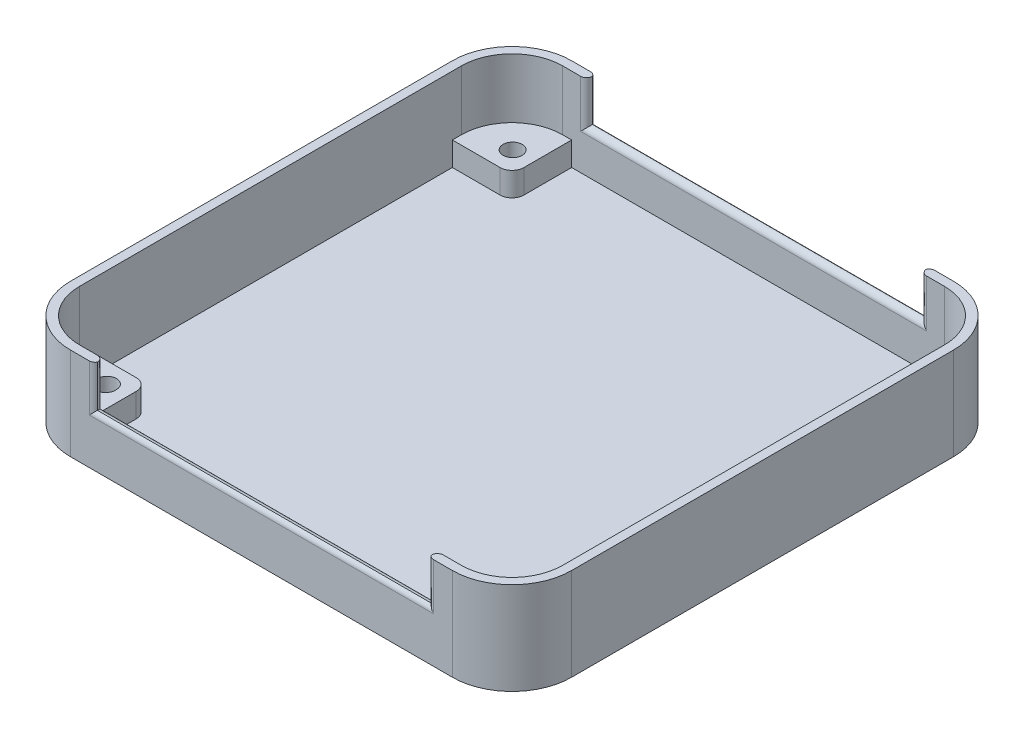
from build123d import *

# Parameters (mm, degrees)
EXTRUDE_1_DEPTH     = 1.5
EXTRUDE_2_DEPTH     = 14
EXTRUDE_3_OUTLINE_R = 1.60000381
EXTRUDE_3_DEPTH     = 4
SKETCH_4_W          = 56
SKETCH_4_H          = 7
CUT_EXTRUDE_1_DEPTH = 2
SKETCH_5_W          = 56
SKETCH_5_H          = 7
CUT_EXTRUDE_2_DEPTH = 2
FILLET_1_R          = 1
FILLET_2_R          = 1


with BuildPart() as part:
    # 草图1 → 凸台-拉伸1 (new body)
    with BuildSketch(Plane(origin=(0, 0, 0), x_dir=(1, 0, 0), z_dir=(0, 1, 0))):
        with BuildLine():
            Line((-32, 42), (32, 42))
            ThreePointArc((32, 42), (39.071067812, 39.071067812), (42, 32))
            Line((42, 32), (42, -32))
            ThreePointArc((42, -32), (39.071067812, -39.071067812), (32, -42))
            Line((32, -42), (-32, -42))
            ThreePointArc((-32, -42), (-39.071067812, -39.071067812), (-42, -32))
            Line((-42, -32), (-42, 32))
            ThreePointArc((-42, 32), (-39.071067812, 39.071067812), (-32, 42))
        make_face()
        with BuildLine():
            ThreePointArc((-32.412680975, -33.885727711), (-34.012684785, -32.285723901), (-35.612688595, -33.885727711))
            ThreePointArc((-35.612688595, -33.885727711), (-34.012684785, -35.485731521), (-32.412680975, -33.885727711))
        make_face(mode=Mode.SUBTRACT)
        with BuildLine():
            ThreePointArc((35.587491745, -33.885727711), (33.987487935, -32.285723901), (32.387484125, -33.885727711))
            ThreePointArc((32.387484125, -33.885727711), (33.987487935, -35.485731521), (35.587491745, -33.885727711))
        make_face(mode=Mode.SUBTRACT)
        with BuildLine():
            ThreePointArc((35.587491745, 34.114445009), (33.987487935, 35.714448819), (32.387484125, 34.114445009))
            ThreePointArc((32.387484125, 34.114445009), (33.987487935, 32.514441199), (35.587491745, 34.114445009))
        make_face(mode=Mode.SUBTRACT)
        with BuildLine():
            ThreePointArc((-32.412680975, 34.114445009), (-34.012684785, 35.714448819), (-35.612688595, 34.114445009))
            ThreePointArc((-35.612688595, 34.114445009), (-34.012684785, 32.514441199), (-32.412680975, 34.114445009))
        make_face(mode=Mode.SUBTRACT)
    extrude(amount=EXTRUDE_1_DEPTH)

    # 草图2 → 凸台-拉伸2 (add)
    with BuildSketch(Plane(origin=(0, 1.5, 0), x_dir=(1, 0, 0), z_dir=(0, 1, 0))):
        with BuildLine():
            Line((32, 42), (-32, 42))
            ThreePointArc((-32, 42), (-39.071067812, 39.071067812), (-42, 32))
            Line((-42, 32), (-42, -32))
            ThreePointArc((-42, -32), (-39.071067812, -39.071067812), (-32, -42))
            Line((-32, -42), (32, -42))
            ThreePointArc((32, -42), (39.071067812, -39.071067812), (42, -32))
            Line((42, -32), (42, 32))
            ThreePointArc((42, 32), (39.071067812, 39.071067812), (32, 42))
        make_face()
        with BuildLine():
            Line((-40.5, 32), (-40.5, -32))
            ThreePointArc((-40.5, -32), (-38.01040764, -38.01040764), (-32, -40.5))
            Line((-32, -40.5), (32, -40.5))
            ThreePointArc((32, -40.5), (38.01040764, -38.01040764), (40.5, -32))
            Line((40.5, -32), (40.5, 32))
            ThreePointArc((40.5, 32), (38.01040764, 38.01040764), (32, 40.5))
            Line((32, 40.5), (-32, 40.5))
            ThreePointArc((-32, 40.5), (-38.01040764, 38.01040764), (-40.5, 32))
        make_face(mode=Mode.SUBTRACT)
    extrude(amount=EXTRUDE_2_DEPTH)

    # 凸台-拉伸3: read off the stored shape, not the designer's step
    # 凸台-拉伸3 outline → 凸台-拉伸3 (add)
    # profile 1 of 4: a face of its own
    with BuildSketch(Plane(origin=(0, 1.5, 0), x_dir=(1, 0, 0), z_dir=(0, 1, 0))):
        with BuildLine():
            ThreePointArc((-32.5, 30.5), (-31.085786438, 31.085786438), (-30.5, 32.5))
            Line((-30.5, 32.5), (-30.5, 40.5))
            Line((-30.5, 40.5), (-32, 40.5))
            ThreePointArc((-32, 40.5), (-38.01040764, 38.01040764), (-40.5, 32))
            Line((-40.5, 32), (-40.5, 30.5))
            Line((-40.5, 30.5), (-32.5, 30.5))
        make_face()
        with Locations((-34.012684785, 34.114445009)):
            Circle(EXTRUDE_3_OUTLINE_R, mode=Mode.SUBTRACT)
    # profile 2 of 4: a face of its own
    with BuildSketch(Plane(origin=(0, 1.5, 0), x_dir=(1, 0, 0), z_dir=(0, 1, 0))):
        with BuildLine():
            Line((32, 40.5), (30.5, 40.5))
            Line((30.5, 40.5), (30.5, 32.5))
            ThreePointArc((30.5, 32.5), (31.085786438, 31.085786438), (32.5, 30.5))
            Line((32.5, 30.5), (40.5, 30.5))
            Line((40.5, 30.5), (40.5, 32))
            ThreePointArc((40.5, 32), (38.01040764, 38.01040764), (32, 40.5))
        make_face()
        with BuildLine():
            ThreePointArc((34.00008636, 32.5144908), (32.387484125, 34.114445009), (34.00008636, 35.714399218))
            ThreePointArc((34.00008636, 35.714399218), (35.612688595, 34.114445009), (34.00008636, 32.5144908))
        make_face(mode=Mode.SUBTRACT)
    # profile 3 of 4: a face of its own
    with BuildSketch(Plane(origin=(0, 1.5, 0), x_dir=(1, 0, 0), z_dir=(0, 1, 0))):
        with BuildLine():
            Line((-32.5, -30.5), (-40.5, -30.5))
            Line((-40.5, -30.5), (-40.5, -32))
            ThreePointArc((-40.5, -32), (-38.01040764, -38.01040764), (-32, -40.5))
            Line((-32, -40.5), (-30.5, -40.5))
            Line((-30.5, -40.5), (-30.5, -32.5))
            ThreePointArc((-30.5, -32.5), (-31.085786438, -31.085786438), (-32.5, -30.5))
        make_face()
        with BuildLine():
            ThreePointArc((-35.608596528, -34.00008636), (-34.012684785, -32.285723901), (-32.416773042, -34.00008636))
            ThreePointArc((-32.416773042, -34.00008636), (-34.012684785, -35.714448819), (-35.608596528, -34.00008636))
        make_face(mode=Mode.SUBTRACT)
    # profile 4 of 4: a face of its own
    with BuildSketch(Plane(origin=(0, 1.5, 0), x_dir=(1, 0, 0), z_dir=(0, 1, 0))):
        with BuildLine():
            Line((40.5, -32), (40.5, -30.5))
            Line((40.5, -30.5), (32.5, -30.5))
            ThreePointArc((32.5, -30.5), (31.085786438, -31.085786438), (30.5, -32.5))
            Line((30.5, -32.5), (30.5, -40.5))
            Line((30.5, -40.5), (32, -40.5))
            ThreePointArc((32, -40.5), (38.01040764, -38.01040764), (40.5, -32))
        make_face()
        with BuildLine():
            ThreePointArc((32.413821191, -34.174838714), (33.81228204, -32.295345654), (35.586351529, -33.825334006))
            ThreePointArc((35.586351529, -33.825334006), (34.18789068, -35.704827066), (32.413821191, -34.174838714))
        make_face(mode=Mode.SUBTRACT)
    extrude(amount=EXTRUDE_3_DEPTH)

    # 草图4 → 切除-拉伸1 (cut)
    with BuildSketch(Plane.XY.offset(42)):
        with Locations((0, 12)):
            Rectangle(SKETCH_4_W, SKETCH_4_H)
    extrude(amount=-CUT_EXTRUDE_1_DEPTH, mode=Mode.SUBTRACT)

    # 草图5 → 切除-拉伸2 (cut)
    with BuildSketch(Plane(origin=(0, 0, -42), x_dir=(-1, 0, 0), z_dir=(0, 0, -1))):
        with Locations((0, 12)):
            Rectangle(SKETCH_5_W, SKETCH_5_H)
    extrude(amount=-CUT_EXTRUDE_2_DEPTH, mode=Mode.SUBTRACT)

    # 圆角1
    fillet_1_edges = [part.edges().sort_by_distance(p)[0] for p in [
        (0, 8.5, 40.5),
        (28, 12, 40.5),
        (-28, 12, 40.5),
        (0, 8.5, -40.5),
        (-28, 12, -40.5),
        (28, 12, -40.5),
    ]]
    fillet(fillet_1_edges, radius=FILLET_1_R)

    # 圆角2
    # the kernel refuses this fillet: 1 mm, written as the material it takes off along each edge
    with BuildSketch(Plane(origin=(-28, 17.665063509, 42), x_dir=(-1, 0, 0), z_dir=(0, -1, 0))) as fillet_2_piece_1:
        with BuildLine():
            CenterArc((0.866025404, 1), FILLET_2_R, 210, 60)
            Line((0, 0.5), (-0.017320508, 0.49))
            ThreePointArc((-0.017320508, 0.49), (-0.02, 0.25), (-0.02, 0))
            Line((-0.02, 0), (0, -0.02))
            Line((0, -0.02), (0.866025404, -0.02))
            Line((0.866025404, -0.02), (0.866025404, 0))
        make_face()
    extrude(amount=9.165063509, mode=Mode.SUBTRACT)
    with BuildSketch(Plane(origin=(-28, 8.5, 42), x_dir=(0, -1, 0), z_dir=(1, 0, 0))) as fillet_2_piece_2:
        with BuildLine():
            CenterArc((0.866025404, 1), FILLET_2_R, 210, 60)
            Line((0, 0.5), (-0.017320508, 0.49))
            ThreePointArc((-0.017320508, 0.49), (-0.02, 0.25), (-0.02, 0))
            Line((-0.02, 0), (0, -0.02))
            Line((0, -0.02), (0.866025404, -0.02))
            Line((0.866025404, -0.02), (0.866025404, 0))
        make_face()
    extrude(amount=56, mode=Mode.SUBTRACT)
    with BuildSketch(Plane(origin=(28, 8.5, 42), x_dir=(0, 0, -1), z_dir=(0, 1, 0))) as fillet_2_piece_3:
        with BuildLine():
            CenterArc((1, -0.866025404), FILLET_2_R, 120, 60)
            Line((0, -0.866025404), (-0.02, -0.866025404))
            Line((-0.02, -0.866025404), (-0.02, 0))
            Line((-0.02, 0), (0, 0.02))
            ThreePointArc((0, 0.02), (0.25, 0.02), (0.49, 0.017320508))
            Line((0.49, 0.017320508), (0.5, 0))
        make_face()
    extrude(amount=9.165063509, mode=Mode.SUBTRACT)
    with BuildSketch(Plane(origin=(-28, 17.665063509, -42), x_dir=(-1, 0, 0), z_dir=(0, -1, 0)), Plane(origin=(28, 8.5, -42), x_dir=(1, 0, 0), z_dir=(0, 1, 0))) as fillet_2_piece_4:
        with BuildLine():
            CenterArc((0.866025404, -1), FILLET_2_R, 90, 60)
            Line((0, -0.5), (-0.017320508, -0.49))
            ThreePointArc((-0.017320508, -0.49), (-0.02, -0.25), (-0.02, 0))
            Line((-0.02, 0), (0, 0.02))
            Line((0, 0.02), (0.866025404, 0.02))
            Line((0.866025404, 0.02), (0.866025404, 0))
        make_face()
    extrude(amount=9.165063509, mode=Mode.SUBTRACT)
    with BuildSketch(Plane(origin=(-28, 8.5, -42), x_dir=(0, -1, 0), z_dir=(1, 0, 0))) as fillet_2_piece_5:
        with BuildLine():
            CenterArc((0.866025404, -1), FILLET_2_R, 90, 60)
            Line((0, -0.5), (-0.017320508, -0.49))
            ThreePointArc((-0.017320508, -0.49), (-0.02, -0.25), (-0.02, 0))
            Line((-0.02, 0), (0, 0.02))
            Line((0, 0.02), (0.866025404, 0.02))
            Line((0.866025404, 0.02), (0.866025404, 0))
        make_face()
    extrude(amount=56, mode=Mode.SUBTRACT)
    with BuildSketch(Plane(origin=(-28, 17.665063509, 42), x_dir=(-1, 0, 0), z_dir=(0, -1, 0))) as fillet_2_piece_6a_section:
        with BuildLine():
            CenterArc((0.866025404, 1), FILLET_2_R, 210, 60)
            Line((0, 0.5), (-0.017320508, 0.49))
            ThreePointArc((-0.017320508, 0.49), (-0.02, 0.25), (-0.02, 0))
            Line((-0.02, 0), (0, -0.02))
            Line((0, -0.02), (0.866025404, -0.02))
            Line((0.866025404, -0.02), (0.866025404, 0))
        make_face()
    fillet_2_piece_6a = extrude(amount=11.330127019, mode=Mode.PRIVATE)
    fillet_2_piece_6a = split(fillet_2_piece_6a, bisect_by=Plane(origin=(-28, 8.5, 42), z_dir=(0, -1, 0)), keep=Keep.TOP, mode=Mode.PRIVATE)
    with BuildSketch(Plane(origin=(-30.165063509, 8.5, 42), x_dir=(0, -1, 0), z_dir=(1, 0, 0))) as fillet_2_piece_6b_section:
        with BuildLine():
            CenterArc((0.866025404, 1), FILLET_2_R, 210, 60)
            Line((0, 0.5), (-0.017320508, 0.49))
            ThreePointArc((-0.017320508, 0.49), (-0.02, 0.25), (-0.02, 0))
            Line((-0.02, 0), (0, -0.02))
            Line((0, -0.02), (0.866025404, -0.02))
            Line((0.866025404, -0.02), (0.866025404, 0))
        make_face()
    fillet_2_piece_6b = extrude(amount=58.165063509, mode=Mode.PRIVATE)
    fillet_2_piece_6b = split(fillet_2_piece_6b, bisect_by=Plane(origin=(-28, 8.5, 42), z_dir=(-1, 0, 0)), keep=Keep.TOP, mode=Mode.PRIVATE)
    fillet_2_piece_6 = fillet_2_piece_6a & fillet_2_piece_6b
    add(fillet_2_piece_6, mode=Mode.SUBTRACT)
    with BuildSketch(Plane(origin=(28, 6.334936491, 42), x_dir=(0, 0, -1), z_dir=(0, 1, 0))) as fillet_2_piece_7a_section:
        with BuildLine():
            CenterArc((1, -0.866025404), FILLET_2_R, 120, 60)
            Line((0, -0.866025404), (-0.02, -0.866025404))
            Line((-0.02, -0.866025404), (-0.02, 0))
            Line((-0.02, 0), (0, 0.02))
            ThreePointArc((0, 0.02), (0.25, 0.02), (0.49, 0.017320508))
            Line((0.49, 0.017320508), (0.5, 0))
        make_face()
    fillet_2_piece_7a = extrude(amount=11.330127019, mode=Mode.PRIVATE)
    fillet_2_piece_7a = split(fillet_2_piece_7a, bisect_by=Plane(origin=(28, 8.5, 42), z_dir=(0, -1, 0)), keep=Keep.TOP, mode=Mode.PRIVATE)
    with BuildSketch(Plane(origin=(-28, 8.5, 42), x_dir=(0, -1, 0), z_dir=(1, 0, 0))) as fillet_2_piece_7b_section:
        with BuildLine():
            CenterArc((0.866025404, 1), FILLET_2_R, 210, 60)
            Line((0, 0.5), (-0.017320508, 0.49))
            ThreePointArc((-0.017320508, 0.49), (-0.02, 0.25), (-0.02, 0))
            Line((-0.02, 0), (0, -0.02))
            Line((0, -0.02), (0.866025404, -0.02))
            Line((0.866025404, -0.02), (0.866025404, 0))
        make_face()
    fillet_2_piece_7b = extrude(amount=58.165063509, mode=Mode.PRIVATE)
    fillet_2_piece_7b = split(fillet_2_piece_7b, bisect_by=Plane(origin=(28, 8.5, 42), z_dir=(1, 0, 0)), keep=Keep.TOP, mode=Mode.PRIVATE)
    fillet_2_piece_7 = fillet_2_piece_7a & fillet_2_piece_7b
    add(fillet_2_piece_7, mode=Mode.SUBTRACT)
    with BuildSketch(Plane(origin=(-30.165063509, 8.5, -42), x_dir=(0, -1, 0), z_dir=(1, 0, 0))) as fillet_2_piece_8a_section:
        with BuildLine():
            CenterArc((0.866025404, -1), FILLET_2_R, 90, 60)
            Line((0, -0.5), (-0.017320508, -0.49))
            ThreePointArc((-0.017320508, -0.49), (-0.02, -0.25), (-0.02, 0))
            Line((-0.02, 0), (0, 0.02))
            Line((0, 0.02), (0.866025404, 0.02))
            Line((0.866025404, 0.02), (0.866025404, 0))
        make_face()
    fillet_2_piece_8a = extrude(amount=58.165063509, mode=Mode.PRIVATE)
    fillet_2_piece_8a = split(fillet_2_piece_8a, bisect_by=Plane(origin=(-28, 8.5, -42), z_dir=(-1, 0, 0)), keep=Keep.TOP, mode=Mode.PRIVATE)
    with BuildSketch(Plane(origin=(-28, 17.665063509, -42), x_dir=(-1, 0, 0), z_dir=(0, -1, 0))) as fillet_2_piece_8b_section:
        with BuildLine():
            CenterArc((0.866025404, -1), FILLET_2_R, 90, 60)
            Line((0, -0.5), (-0.017320508, -0.49))
            ThreePointArc((-0.017320508, -0.49), (-0.02, -0.25), (-0.02, 0))
            Line((-0.02, 0), (0, 0.02))
            Line((0, 0.02), (0.866025404, 0.02))
            Line((0.866025404, 0.02), (0.866025404, 0))
        make_face()
    fillet_2_piece_8b = extrude(amount=11.330127019, mode=Mode.PRIVATE)
    fillet_2_piece_8b = split(fillet_2_piece_8b, bisect_by=Plane(origin=(-28, 8.5, -42), z_dir=(0, -1, 0)), keep=Keep.TOP, mode=Mode.PRIVATE)
    fillet_2_piece_8 = fillet_2_piece_8a & fillet_2_piece_8b
    add(fillet_2_piece_8, mode=Mode.SUBTRACT)
    with BuildSketch(Plane(origin=(28, 6.334936491, -42), x_dir=(1, 0, 0), z_dir=(0, 1, 0))) as fillet_2_piece_9a_section:
        with BuildLine():
            CenterArc((0.866025404, -1), FILLET_2_R, 90, 60)
            Line((0, -0.5), (-0.017320508, -0.49))
            ThreePointArc((-0.017320508, -0.49), (-0.02, -0.25), (-0.02, 0))
            Line((-0.02, 0), (0, 0.02))
            Line((0, 0.02), (0.866025404, 0.02))
            Line((0.866025404, 0.02), (0.866025404, 0))
        make_face()
    fillet_2_piece_9a = extrude(amount=11.330127019, mode=Mode.PRIVATE)
    fillet_2_piece_9a = split(fillet_2_piece_9a, bisect_by=Plane(origin=(28, 8.5, -42), z_dir=(0, -1, 0)), keep=Keep.TOP, mode=Mode.PRIVATE)
    with BuildSketch(Plane(origin=(-28, 8.5, -42), x_dir=(0, -1, 0), z_dir=(1, 0, 0))) as fillet_2_piece_9b_section:
        with BuildLine():
            CenterArc((0.866025404, -1), FILLET_2_R, 90, 60)
            Line((0, -0.5), (-0.017320508, -0.49))
            ThreePointArc((-0.017320508, -0.49), (-0.02, -0.25), (-0.02, 0))
            Line((-0.02, 0), (0, 0.02))
            Line((0, 0.02), (0.866025404, 0.02))
            Line((0.866025404, 0.02), (0.866025404, 0))
        make_face()
    fillet_2_piece_9b = extrude(amount=58.165063509, mode=Mode.PRIVATE)
    fillet_2_piece_9b = split(fillet_2_piece_9b, bisect_by=Plane(origin=(28, 8.5, -42), z_dir=(1, 0, 0)), keep=Keep.TOP, mode=Mode.PRIVATE)
    fillet_2_piece_9 = fillet_2_piece_9a & fillet_2_piece_9b
    add(fillet_2_piece_9, mode=Mode.SUBTRACT)


solid = part.part
